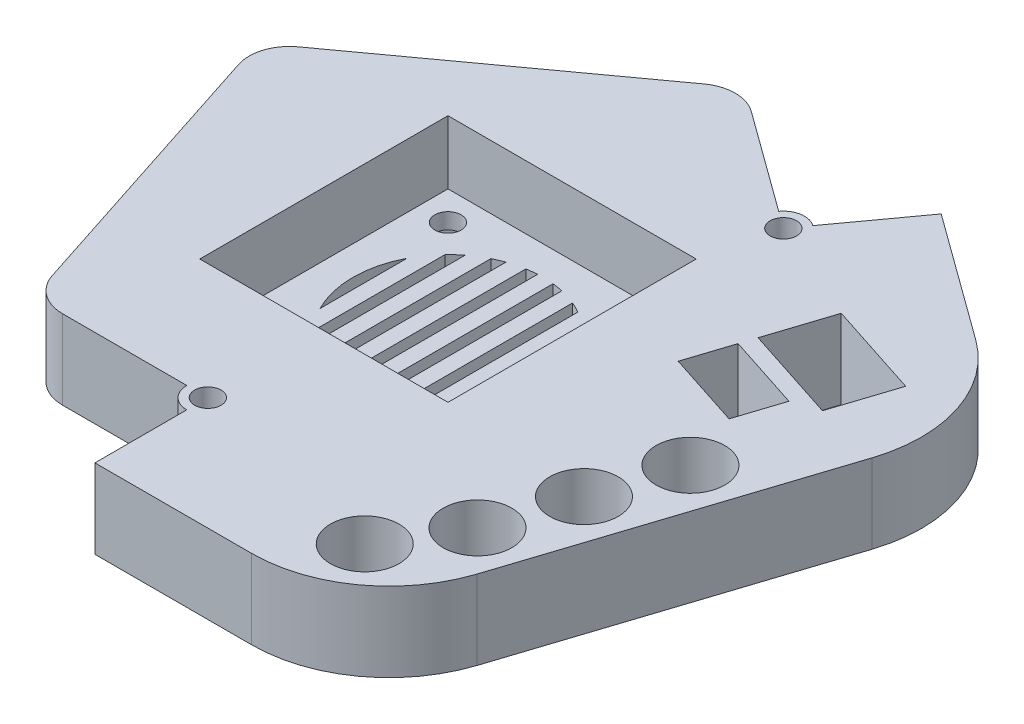
from build123d import *

# Parameters (mm, degrees)
BOSS_EXTRUDE1_DEPTH = 10
BOSS_EXTRUDE2_DEPTH = 5
CUT_EXTRUDE1_DEPTH  = 107.586426403
SKETCH7_R           = 2.5
CUT_EXTRUDE2_DEPTH  = 5
SKETCH6_R           = 4
SKETCH6_R_2         = 2.5
BOSS_EXTRUDE4_DEPTH = 5
SKETCH8_W           = 93.505487076
SKETCH8_H           = 78.321413714
CUT_EXTRUDE3_DEPTH  = 5
BOSS_EXTRUDE5_DEPTH = 32.15
CUT_EXTRUDE4_REACH  = 105.391
FILLET1_R           = 10
SKETCH13_R          = 6.5
CUT_EXTRUDE6_DEPTH  = 10
SKETCH17_W          = 58.231833944
SKETCH17_H          = 55.278794696
BOSS_EXTRUDE6_DEPTH = 5
BOSS_EXTRUDE7_START = 10
SKETCH19_R          = 2.5
SKETCH19_R_2        = 6.5
BOSS_EXTRUDE7_DEPTH = 10
SKETCH24_W          = 47
SKETCH24_H          = 47
CUT_EXTRUDE9_DEPTH  = 12
CUT_EXTRUDE11_DEPTH = 5


with BuildPart() as part:
    # Sketch1 → Boss-Extrude1 (new body)
    with BuildSketch(Plane(origin=(0, 0, 0), x_dir=(1, 0, 0), z_dir=(0, 1, 0))):
        with BuildLine():
            ThreePointArc((-34.753628463, 6.582719409), (-34.753628463, 11.292138403), (-31.985501431, 15.102138403))
            Line((-31.985501431, 15.102138403), (-4.478923622, 35.086836981))
            ThreePointArc((-4.478923622, 35.086836981), (0, 36.542127484), (4.478923622, 35.086836981))
            Line((4.478923622, 35.086836981), (31.985501431, 15.102138403))
            ThreePointArc((31.985501431, 15.102138403), (34.753628463, 11.292138403), (34.753628463, 6.582719409))
            Line((34.753628463, 6.582719409), (24.247050654, -25.753202145))
            ThreePointArc((24.247050654, -25.753202145), (21.478923622, -29.563202145), (17, -31.018492648))
            Line((17, -31.018492648), (-17, -31.018492648))
            ThreePointArc((-17, -31.018492648), (-21.478923622, -29.563202145), (-24.247050654, -25.753202145))
            Line((-24.247050654, -25.753202145), (-34.753628463, 6.582719409))
        make_face()
        with BuildLine():
            Line((-31.015314258, 5.368067493), (-21.936645415, -22.573202145))
            ThreePointArc((-21.936645415, -22.573202145), (-19.168518383, -26.383202145), (-14.689594761, -27.838492648))
            Line((-14.689594761, -27.838492648), (14.689594761, -27.838492648))
            ThreePointArc((14.689594761, -27.838492648), (19.168518383, -26.383202145), (21.936645415, -22.573202145))
            Line((21.936645415, -22.573202145), (31.015314258, 5.368067493))
            ThreePointArc((31.015314258, 5.368067493), (31.015314258, 10.077486487), (28.247187227, 13.887486487))
            Line((28.247187227, 13.887486487), (4.478923622, 31.156140813))
            ThreePointArc((4.478923622, 31.156140813), (0, 32.611431316), (-4.478923622, 31.156140813))
            Line((-4.478923622, 31.156140813), (-28.247187227, 13.887486487))
            ThreePointArc((-28.247187227, 13.887486487), (-31.015314258, 10.077486487), (-31.015314258, 5.368067493))
        make_face(mode=Mode.SUBTRACT)
    extrude(amount=BOSS_EXTRUDE1_DEPTH)

    # Sketch2 → Boss-Extrude2 (add)
    with BuildSketch(Plane.XZ):
        with BuildLine():
            Line((-54.417064185, 48.898663309), (-72.766242859, -7.574301818))
            ThreePointArc((-72.766242859, -7.574301818), (-72.766242859, -23.643185526), (-63.321189995, -36.643185526))
            Line((-63.321189995, -36.643185526), (-15.28241656, -71.54539742))
            ThreePointArc((-15.28241656, -71.54539742), (0, -76.510955566), (15.28241656, -71.54539742))
            Line((15.28241656, -71.54539742), (63.321189995, -36.643185526))
            ThreePointArc((63.321189995, -36.643185526), (72.766242859, -23.643185526), (72.766242859, -7.574301818))
            Line((72.766242859, -7.574301818), (54.417064185, 48.898663309))
            ThreePointArc((54.417064185, 48.898663309), (44.972011321, 61.898663309), (29.689594761, 66.864221455))
            Line((29.689594761, 66.864221455), (-29.689594761, 66.864221455))
            ThreePointArc((-29.689594761, 66.864221455), (-44.972011321, 61.898663309), (-54.417064185, 48.898663309))
        make_face()
    extrude(amount=-BOSS_EXTRUDE2_DEPTH)

    # Sketch4 → Cut-Extrude1 (cut, through all)
    with BuildSketch(Plane(origin=(0, 5, 0), x_dir=(1, 0, 0), z_dir=(0, 1, 0))):
        with BuildLine():
            Line((4.478923622, 52.948019256), (26.725709422, 36.784783261))
            Line((26.725709422, 36.784783261), (39.301803277, 54.094291473))
            Line((39.301803277, 54.094291473), (15.28241656, 71.54539742))
            ThreePointArc((15.28241656, 71.54539742), (0, 76.510955566), (-15.28241656, 71.54539742))
            Line((-15.28241656, 71.54539742), (-63.321189995, 36.643185526))
            ThreePointArc((-63.321189995, 36.643185526), (-72.766242859, 23.643185526), (-72.766242859, 7.574301818))
            Line((-72.766242859, 7.574301818), (-54.417064185, -48.898663309))
            ThreePointArc((-54.417064185, -48.898663309), (-44.972011321, -61.898663309), (-29.689594761, -66.864221455))
            Line((-29.689594761, -66.864221455), (0, -66.864221455))
            Line((0, -66.864221455), (0, -45.468492648))
            Line((0, -45.468492648), (-27.49853953, -45.468492648))
            ThreePointArc((-27.49853953, -45.468492648), (-31.977463152, -44.013202145), (-34.745590184, -40.203202145))
            Line((-34.745590184, -40.203202145), (-51.740622254, 12.102128271))
            ThreePointArc((-51.740622254, 12.102128271), (-51.740622254, 16.811547266), (-48.972495222, 20.621547266))
            Line((-48.972495222, 20.621547266), (-4.478923622, 52.948019256))
            ThreePointArc((-4.478923622, 52.948019256), (0, 54.403309759), (4.478923622, 52.948019256))
        make_face()
    extrude(amount=-CUT_EXTRUDE1_DEPTH, mode=Mode.SUBTRACT)

    # Sketch7 → Cut-Extrude2 (cut)
    with BuildSketch(Plane(origin=(0, 5, 0), x_dir=(1, 0, 0), z_dir=(0, 1, 0))):
        with BuildLine():
            Line((12.806248475, -18.5), (-12.806248475, -18.5))
            ThreePointArc((-12.806248475, -18.5), (0, -22.5), (12.806248475, -18.5))
        make_face()
        with BuildLine():
            ThreePointArc((-19.032866311, -12), (-17.540474197, -14.091904234), (-15.81929202, -16))
            Line((-15.81929202, -16), (15.81929202, -16))
            ThreePointArc((15.81929202, -16), (17.540474197, -14.091904234), (19.032866311, -12))
            Line((19.032866311, -12), (-19.032866311, -12))
        make_face()
        with BuildLine():
            ThreePointArc((-21.817424229, -5.5), (-21.201295804, -7.533595173), (-20.396078054, -9.5))
            Line((-20.396078054, -9.5), (20.396078054, -9.5))
            ThreePointArc((20.396078054, -9.5), (21.201295804, -7.533595173), (21.817424229, -5.5))
            Line((21.817424229, -5.5), (-21.817424229, -5.5))
        make_face()
        with BuildLine():
            ThreePointArc((22.299103121, -3), (22.5, 0), (22.299103121, 3))
            Line((22.299103121, 3), (-22.299103121, 3))
            ThreePointArc((-22.299103121, 3), (-22.5, 0), (-22.299103121, -3))
            Line((-22.299103121, -3), (22.299103121, -3))
        make_face()
        with BuildLine():
            ThreePointArc((12.806248475, 18.5), (0, 22.5), (-12.806248475, 18.5))
            Line((-12.806248475, 18.5), (12.806248475, 18.5))
        make_face()
        with BuildLine():
            Line((-21.817424229, 5.5), (21.817424229, 5.5))
            ThreePointArc((21.817424229, 5.5), (21.201295804, 7.533595173), (20.396078054, 9.5))
            Line((20.396078054, 9.5), (-20.396078054, 9.5))
            ThreePointArc((-20.396078054, 9.5), (-21.201295804, 7.533595173), (-21.817424229, 5.5))
        make_face()
        with BuildLine():
            ThreePointArc((19.032866311, 12), (17.540474197, 14.091904234), (15.81929202, 16))
            Line((15.81929202, 16), (-15.81929202, 16))
            ThreePointArc((-15.81929202, 16), (-17.540474197, 14.091904234), (-19.032866311, 12))
            Line((-19.032866311, 12), (19.032866311, 12))
        make_face()
        with Locations((26.725709422, 36.784783261)):
            Circle(SKETCH7_R)
        with Locations((0, -45.468492648)):
            Circle(SKETCH7_R)
    extrude(amount=-CUT_EXTRUDE2_DEPTH, mode=Mode.SUBTRACT)

    # Sketch6 → Boss-Extrude4 (add)
    # profile 1 of 2: a face of its own
    with BuildSketch(Plane(origin=(0, 5, 0), x_dir=(1, 0, 0), z_dir=(0, 1, 0))):
        with Locations((26.725709422, 36.784783261)):
            Circle(SKETCH6_R)
        with Locations(Location((26.725709422, 36.784783261, 0), (0, 0, 270))):
            Circle(SKETCH6_R_2, mode=Mode.SUBTRACT)
    # profile 2 of 2: a face of its own
    with BuildSketch(Plane(origin=(0, 5, 0), x_dir=(1, 0, 0), z_dir=(0, 1, 0))):
        with Locations((0, -45.468492648)):
            Circle(SKETCH6_R)
        with Locations(Location((0, -45.468492648, 0), (0, 0, 270))):
            Circle(SKETCH6_R_2, mode=Mode.SUBTRACT)
    extrude(amount=-BOSS_EXTRUDE4_DEPTH)

    # Sketch8 → Cut-Extrude3 (cut)
    with BuildSketch(Plane(origin=(0, 10, 0), x_dir=(1, 0, 0), z_dir=(0, 1, 0))):
        Rectangle(SKETCH8_W, SKETCH8_H)
    extrude(amount=-CUT_EXTRUDE3_DEPTH, mode=Mode.SUBTRACT)

    # Sketch9 → Boss-Extrude5 (add)
    with BuildSketch(Plane(origin=(0, 5, 0), x_dir=(1, 0, 0), z_dir=(0, 1, 0))):
        with BuildLine():
            Line((36.68778345, 16.630002448), (4.478923622, 40.031108891))
            ThreePointArc((4.478923622, 40.031108891), (0, 41.486399394), (-4.478923622, 40.031108891))
            Line((-4.478923622, 40.031108891), (-36.68778345, 16.630002448))
            ThreePointArc((-36.68778345, 16.630002448), (-39.455910481, 12.820002448), (-39.455910481, 8.110583454))
            Line((-39.455910481, 8.110583454), (-27.153220766, -29.753202145))
            ThreePointArc((-27.153220766, -29.753202145), (-24.385093734, -33.563202145), (-19.906170112, -35.018492648))
            Line((-19.906170112, -35.018492648), (19.906170112, -35.018492648))
            ThreePointArc((19.906170112, -35.018492648), (24.385093734, -33.563202145), (27.153220766, -29.753202145))
            Line((27.153220766, -29.753202145), (39.455910481, 8.110583454))
            ThreePointArc((39.455910481, 8.110583454), (39.455910481, 12.820002448), (36.68778345, 16.630002448))
        make_face()
        with BuildLine():
            Line((-4.478923622, 35.086836981), (-31.985501431, 15.102138403))
            ThreePointArc((-31.985501431, 15.102138403), (-34.753628463, 11.292138403), (-34.753628463, 6.582719409))
            Line((-34.753628463, 6.582719409), (-24.247050654, -25.753202145))
            ThreePointArc((-24.247050654, -25.753202145), (-21.478923622, -29.563202145), (-17, -31.018492648))
            Line((-17, -31.018492648), (17, -31.018492648))
            ThreePointArc((17, -31.018492648), (21.478923622, -29.563202145), (24.247050654, -25.753202145))
            Line((24.247050654, -25.753202145), (34.753628463, 6.582719409))
            ThreePointArc((34.753628463, 6.582719409), (34.753628463, 11.292138403), (31.985501431, 15.102138403))
            Line((31.985501431, 15.102138403), (4.478923622, 35.086836981))
            ThreePointArc((4.478923622, 35.086836981), (0, 36.542127484), (-4.478923622, 35.086836981))
        make_face(mode=Mode.SUBTRACT)
    extrude(amount=-BOSS_EXTRUDE5_DEPTH)

    # Sketch12 → Cut-Extrude4 (cut, up to next)
    with BuildSketch(Plane.XZ, mode=Mode.PRIVATE) as cut_extrude4_sk1:
        Polygon((35.432126528, -25.709759722), (13.605683662, 41.465124163), (22.841397396, 44.465989464), (44.667840263, -22.708894421), align=None)
    cut_extrude4_tool1 = extrude(cut_extrude4_sk1.sketch, amount=CUT_EXTRUDE4_REACH, mode=Mode.PRIVATE) & part.part
    add(cut_extrude4_tool1.solids().sort_by_distance((29.136762, 0, 9.378115))[0], mode=Mode.SUBTRACT)

    # Fillet1
    # the kernel refuses this fillet: 10 mm, written as the material it takes off along each edge
    with BuildSketch(Plane(origin=(31.985501431, 0, -15.102138403), x_dir=(0.3090169943749442, 0, -0.9510565162951545), z_dir=(0, -1, 0))) as fillet1_piece_1:
        with BuildLine():
            CenterArc((12.38432395, -5.754350164), FILLET1_R, 144.869897646, 53.130102354)
            Line((2.873758787, -8.844520108), (0, 0))
            Line((0, 0), (4.205848897, 0))
        make_face()
    extrude(amount=50.399196962, mode=Mode.SUBTRACT)
    with BuildSketch(Plane(origin=(17, 0, 31.018492648), x_dir=(-0.3090169943749449, 0, 0.9510565162951543), z_dir=(0, -1, 0))) as fillet1_piece_2:
        with BuildLine():
            CenterArc((12.38432395, 5.754350164), FILLET1_R, 162, 53.130102354)
            Line((2.873758787, 8.844520108), (0, 0))
            Line((0, 0), (4.205848897, 0))
        make_face()
    extrude(amount=50.399196962, mode=Mode.SUBTRACT)

    # Sketch13 → Cut-Extrude6 (cut)
    with BuildSketch(Plane(origin=(0, 5, -5), x_dir=(-1, 0, 0), z_dir=(0, -1, 0))):
        Polygon((-38.55823872, 0.038566227), (-41.339391669, 8.598074874), (-55.605239414, 3.962819958), (-52.824086464, -4.596688688), align=None)
        Polygon((-60.336516462, 5.57992153), (-42.266442653, 11.451244423), (-46.129155082, 23.339450876), (-64.199228892, 17.468127983), align=None)
        with Locations(Location((-56.783736792, -15.8721482, 0), (0, 0, 270))):
            Circle(SKETCH13_R)
        with Locations(Location((-51.839464882, -31.089052461, 0), (0, 0, 270))):
            Circle(SKETCH13_R)
        with Locations(Location((-46.895192972, -46.305956722, 0), (0, 0, 270))):
            Circle(SKETCH13_R)
        with Locations(Location((-38.832765548, -59.59930165, 0), (0, 0, 270))):
            Circle(SKETCH13_R)
    extrude(amount=CUT_EXTRUDE6_DEPTH, mode=Mode.SUBTRACT)

    # Sketch17 → Boss-Extrude6 (add)
    with BuildSketch(Plane(origin=(0, 5, 0), x_dir=(1, 0, 0), z_dir=(0, 1, 0))):
        with Locations((-5.052192747, 3)):
            Rectangle(SKETCH17_W, SKETCH17_H)
    extrude(amount=-BOSS_EXTRUDE6_DEPTH)

    # Sketch19 → Boss-Extrude7 (add)
    with BuildSketch(Plane(origin=(0, 5, 0), x_dir=(1, 0, 0), z_dir=(0, 1, 0)).offset(BOSS_EXTRUDE7_START)):
        with BuildLine():
            Line((-51.740622254, 12.102128271), (-34.745590184, -40.203202145))
            ThreePointArc((-34.745590184, -40.203202145), (-31.977463152, -44.013202145), (-27.49853953, -45.468492648))
            Line((-27.49853953, -45.468492648), (-4, -45.468492648))
            ThreePointArc((-4, -45.468492648), (-2.828427125, -48.296919773), (0, -49.468492648))
            Line((0, -49.468492648), (0, -66.864221455))
            Line((0, -66.864221455), (29.689594761, -66.864221455))
            ThreePointArc((29.689594761, -66.864221455), (44.972011321, -61.898663309), (54.417064185, -48.898663309))
            Line((54.417064185, -48.898663309), (72.766242859, 7.574301818))
            ThreePointArc((72.766242859, 7.574301818), (72.766242859, 23.643185526), (63.321189995, 36.643185526))
            Line((63.321189995, 36.643185526), (39.301803277, 54.094291473))
            Line((39.301803277, 54.094291473), (29.076850432, 40.020851238))
            ThreePointArc((29.076850432, 40.020851238), (26.099971562, 40.735536623), (23.489641445, 39.13592427))
            Line((23.489641445, 39.13592427), (4.478923622, 52.948019256))
            ThreePointArc((4.478923622, 52.948019256), (0, 54.403309759), (-4.478923622, 52.948019256))
            Line((-4.478923622, 52.948019256), (-48.972495222, 20.621547266))
            ThreePointArc((-48.972495222, 20.621547266), (-51.740622254, 16.811547266), (-51.740622254, 12.102128271))
        make_face()
        with Locations(Location((26.725709422, 36.784783261, 0), (0, 0, 270))):
            Circle(SKETCH19_R, mode=Mode.SUBTRACT)
        with Locations(Location((0, -45.468492648, 0), (0, 0, 270))):
            Circle(SKETCH19_R, mode=Mode.SUBTRACT)
        with Locations(Location((56.783736792, -10.8721482, 0), (0, 0, 270))):
            Circle(SKETCH19_R_2, mode=Mode.SUBTRACT)
        with Locations(Location((51.839464882, -26.089052461, 0), (0, 0, 270))):
            Circle(SKETCH19_R_2, mode=Mode.SUBTRACT)
        with Locations(Location((46.895192972, -41.305956722, 0), (0, 0, 270))):
            Circle(SKETCH19_R_2, mode=Mode.SUBTRACT)
        with Locations(Location((38.832765548, -54.59930165, 0), (0, 0, 270))):
            Circle(SKETCH19_R_2, mode=Mode.SUBTRACT)
        Polygon((60.336516462, 10.57992153), (64.199228892, 22.468127983), (46.129155082, 28.339450876), (42.266442653, 16.451244423), align=None, mode=Mode.SUBTRACT)
        Polygon((52.824086464, 0.403311312), (55.605239414, 8.962819958), (41.339391669, 13.598074874), (38.55823872, 5.038566227), align=None, mode=Mode.SUBTRACT)
    extrude(amount=-BOSS_EXTRUDE7_DEPTH)

    # Sketch24 → Cut-Extrude9 (cut)
    with BuildSketch(Plane(origin=(0, 15, 0), x_dir=(1, 0, 0), z_dir=(0, 1, 0))):
        Rectangle(SKETCH24_W, SKETCH24_H)
    extrude(amount=-CUT_EXTRUDE9_DEPTH, mode=Mode.SUBTRACT)

    # Sketch20 → Cut-Extrude11 (cut)
    with BuildSketch(Plane(origin=(0, 0, 0), x_dir=(1, 0, 0), z_dir=(0, 1, 0))):
        with BuildLine():
            Line((-16, -8.246211251), (-16, 8.246211251))
            ThreePointArc((-16, 8.246211251), (-17.492855679, 4.242640709), (-18, 4.4e-08))
            ThreePointArc((-18, 4.4e-08), (-17.49285569, -4.242640666), (-16, -8.246211251))
        make_face()
        with BuildLine():
            ThreePointArc((-11, 14.247806849), (-12.033624459, 13.386257221), (-13, 12.449899598))
            Line((-13, 12.449899598), (-13, -12.449899598))
            ThreePointArc((-13, -12.449899598), (-12.033624459, -13.386257221), (-11, -14.247806849))
            Line((-11, -14.247806849), (-11, 14.247806849))
        make_face()
        with BuildLine():
            ThreePointArc((-6, 16.970562748), (-7.012770422, 16.577727559), (-8, 16.124515497))
            Line((-8, 16.124515497), (-8, -16.124515497))
            ThreePointArc((-8, -16.124515497), (-7.012770422, -16.577727559), (-6, -16.970562748))
            Line((-6, -16.970562748), (-6, 16.970562748))
        make_face()
        with BuildLine():
            ThreePointArc((-1, 17.972200756), (-2.003132466, 17.888193322), (-3, 17.748239349))
            Line((-3, 17.748239349), (-3, -17.748239349))
            ThreePointArc((-3, -17.748239349), (-2.003132466, -17.888193322), (-1, -17.972200756))
            Line((-1, -17.972200756), (-1, 17.972200756))
        make_face()
        with BuildLine():
            Line((2, 17.88854382), (2, -17.88854382))
            ThreePointArc((2, -17.88854382), (3.004773708, -17.747431785), (4, -17.549928775))
            Line((4, -17.549928775), (4, 17.549928775))
            ThreePointArc((4, 17.549928775), (3.004773708, 17.747431785), (2, 17.88854382))
        make_face()
        with BuildLine():
            Line((7, 16.583123952), (7, -16.583123952))
            ThreePointArc((7, -16.583123952), (8.015443871, -16.11684397), (9, -15.588457268))
            Line((9, -15.588457268), (9, 15.588457268))
            ThreePointArc((9, 15.588457268), (8.015443871, 16.11684397), (7, 16.583123952))
        make_face()
        with BuildLine():
            Line((14, -11.313708499), (14, 11.313708499))
            ThreePointArc((14, 11.313708499), (13.042443642, 12.405428805), (12, 13.416407865))
            Line((12, 13.416407865), (12, -13.416407865))
            ThreePointArc((12, -13.416407865), (13.042443642, -12.405428805), (14, -11.313708499))
        make_face()
        with BuildLine():
            ThreePointArc((17, -5.916079783), (17.748239349, -3), (18, 0))
            ThreePointArc((18, 0), (17.748239349, 3), (17, 5.916079783))
            Line((17, 5.916079783), (17, -5.916079783))
        make_face()
        with BuildLine():
            ThreePointArc((18, -15.5), (16.232233047, -16.232233047), (15.5, -18))
            Line((15.5, -18), (18, -18))
            Line((18, -18), (18, -15.5))
        make_face()
        with BuildLine():
            Line((18, -18), (15.5, -18))
            ThreePointArc((15.5, -18), (18, -20.5), (20.5, -18))
            ThreePointArc((20.5, -18), (19.767766953, -16.232233047), (18, -15.5))
            Line((18, -15.5), (18, -18))
        make_face()
        with BuildLine():
            ThreePointArc((-15.5, -18), (-16.232233047, -16.232233047), (-18, -15.5))
            Line((-18, -15.5), (-18, -18))
            Line((-18, -18), (-15.5, -18))
        make_face()
        with BuildLine():
            Line((-18, -18), (-18, -15.5))
            ThreePointArc((-18, -15.5), (-19.767766953, -19.767766953), (-15.5, -18))
            Line((-15.5, -18), (-18, -18))
        make_face()
        with BuildLine():
            ThreePointArc((-15.5, 18), (-19.767766953, 19.767766953), (-18, 15.5))
            Line((-18, 15.5), (-18, 18))
            Line((-18, 18), (-15.5, 18))
        make_face()
        with BuildLine():
            Line((-18, 18), (-18, 15.5))
            ThreePointArc((-18, 15.5), (-16.232233047, 16.232233047), (-15.5, 18))
            Line((-15.5, 18), (-18, 18))
        make_face()
        with BuildLine():
            ThreePointArc((20.5, 18), (18, 20.5), (15.5, 18))
            Line((15.5, 18), (18, 18))
            Line((18, 18), (18, 15.5))
            ThreePointArc((18, 15.5), (19.767766953, 16.232233047), (20.5, 18))
        make_face()
        with BuildLine():
            Line((18, 18), (15.5, 18))
            ThreePointArc((15.5, 18), (16.232233047, 16.232233047), (18, 15.5))
            Line((18, 15.5), (18, 18))
        make_face()
    extrude(amount=CUT_EXTRUDE11_DEPTH, mode=Mode.SUBTRACT)


solid = part.part
